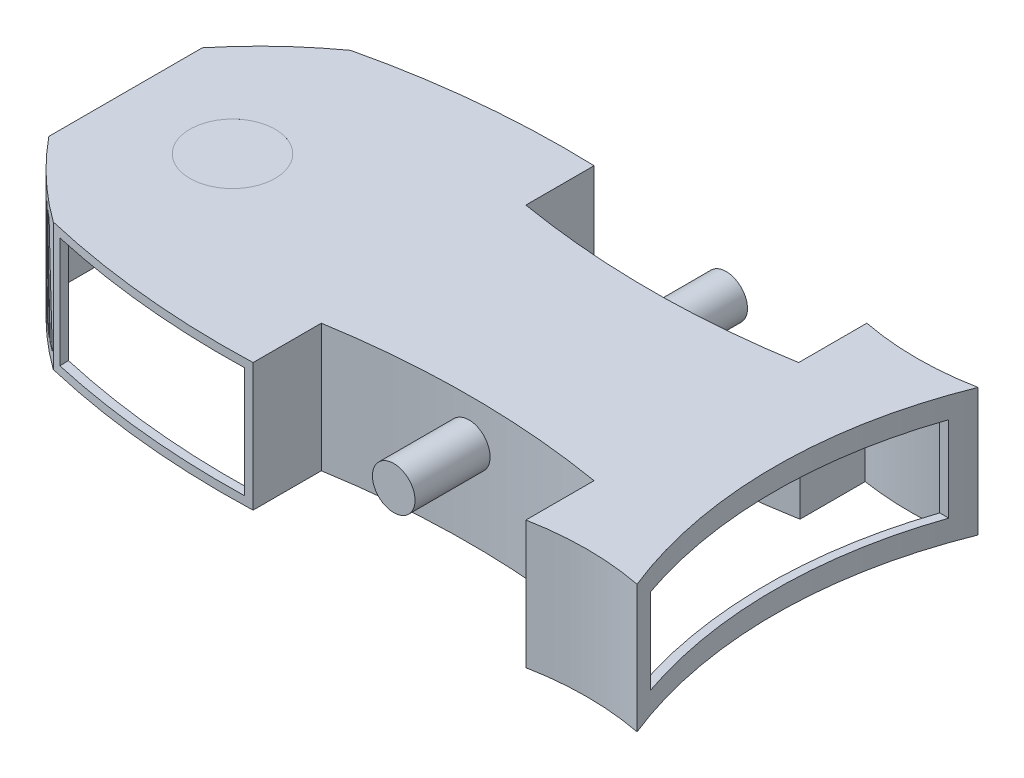
from build123d import *

# Parameters (mm, degrees)
BOSS_EXTRUDE2_DEPTH     = 38.1
F_3DSKETCH1_R           = 6.35
BOSS_EXTRUDE4_DEPTH     = 19.05
SHELL2_T                = -2.54
SKETCH6_R               = 12.7
CUT_EXTRUDE1_DEPTH      = 0.00254
CUT_EXTRUDE2_DEPTH      = 158.777237848
CUT_EXTRUDE2_DEPTH_BACK = 158.777237848
SKETCH7_W               = 60.703915542
SKETCH7_H               = 33.02
SKETCH8_W               = 88.9
SKETCH8_H               = 25.4
CUT_EXTRUDE4_DEPTH      = 16.51
CUT_EXTRUDE5_DEPTH      = 8.255
CUT_EXTRUDE6_DEPTH      = 8.255


with BuildPart() as part:
    # Sketch2 → Boss-Extrude2 (new body)
    with BuildSketch(Plane(origin=(0, 0, 0), x_dir=(1, 0, 0), z_dir=(0, 1, 0))):
        with BuildLine():
            Line((-110.287885986, 22.86), (-110.287885986, -22.86))
            ThreePointArc((-110.287885986, -22.86), (-99.613176325, -34.311972563), (-87.544453722, -44.284085511))
            ThreePointArc((-87.544453722, -44.284085511), (-54.73623967, -49.744240151), (-21.493532664, -50.8))
            Line((-21.493532664, -50.8), (-21.493532664, -30.48))
            ThreePointArc((-21.493532664, -30.48), (19.146467336, -27.087614792), (59.786467336, -30.48))
            Line((59.786467336, -30.48), (59.786467336, -50.8))
            ThreePointArc((59.786467336, -50.8), (76.349290675, -49.20544454), (92.912114014, -50.8))
            ThreePointArc((92.912114014, -50.8), (83.089159594, 0), (92.912114014, 50.8))
            ThreePointArc((92.912114014, 50.8), (76.349290675, 49.20544454), (59.786467336, 50.8))
            Line((59.786467336, 50.8), (59.786467336, 30.48))
            ThreePointArc((59.786467336, 30.48), (19.146467336, 27.087614792), (-21.493532664, 30.48))
            Line((-21.493532664, 30.48), (-21.493532664, 50.8))
            ThreePointArc((-21.493532664, 50.8), (-54.73623967, 49.744240151), (-87.544453722, 44.284085511))
            ThreePointArc((-87.544453722, 44.284085511), (-99.613176325, 34.311972563), (-110.287885986, 22.86))
        make_face()
    extrude(amount=BOSS_EXTRUDE2_DEPTH)

    # 3DSketch1 → Boss-Extrude4 (add, symmetric)
    with BuildSketch(Plane(origin=(19.146467336, 25.4, 30.48), x_dir=(-1, 0, 0), z_dir=(0, 0, -1))):
        Circle(F_3DSKETCH1_R)
    boss_extrude4 = extrude(amount=BOSS_EXTRUDE4_DEPTH, both=True)

    # Mirror2: Boss-Extrude4 across plane
    add(boss_extrude4.mirror(Plane(origin=(0, 0, 0), x_dir=(1, 0, 0), z_dir=(0, 0, -1))))

    # Shell2
    shell2_openings = [part.faces().sort_by_distance(p)[0] for p in [
        (-14.551940984, 0, 0),
    ]]
    offset(amount=SHELL2_T, openings=shell2_openings, kind=Kind.INTERSECTION)

    # Sketch6 → Cut-Extrude1 (cut)
    with BuildSketch(Plane(origin=(0, 38.1, 0), x_dir=(1, 0, 0), z_dir=(0, 1, 0))):
        with Locations((-78.424817078, 0)):
            Circle(SKETCH6_R)
    extrude(amount=-CUT_EXTRUDE1_DEPTH, mode=Mode.SUBTRACT)

    # Sketch7 → Cut-Extrude2 (cut, two sides: drawn at the far end of the back side and taken through both)
    with BuildSketch(Plane(origin=(-21.493532664, 0, 50.8), x_dir=(0.9993933308581496, 0, -0.034827722237509656), z_dir=(0.034827722237509656, 0, 0.9993933308581497)).offset(-CUT_EXTRUDE2_DEPTH_BACK)):
        with Locations((-32.891957771, 19.05)):
            Rectangle(SKETCH7_W, SKETCH7_H)
    extrude(amount=CUT_EXTRUDE2_DEPTH + CUT_EXTRUDE2_DEPTH_BACK, mode=Mode.SUBTRACT)

    # Sketch8 → Cut-Extrude4 (cut)
    with BuildSketch(Plane.ZY.offset(-92.912114014)):
        with Locations((0, 19.05)):
            Rectangle(SKETCH8_W, SKETCH8_H)
    extrude(amount=CUT_EXTRUDE4_DEPTH, mode=Mode.SUBTRACT)

    # Sketch9 → Cut-Extrude5 (cut, symmetric)
    with BuildSketch(Plane(origin=(-87.544453722, 0, 44.284085511), x_dir=(0.8106214663818172, 0, 0.5855705237125519), z_dir=(-0.5855705237125519, 0, 0.8106214663818172))):
        Polygon((-29.711627385, 34.29), (-26.301134111, 34.29), (-20.926687739, 3.81), (-24.337181013, 3.81), align=None)
        Polygon((-19.423009078, 3.81), (-24.79745545, 34.29), (-21.386962176, 34.29), (-16.012515804, 3.81), align=None)
        Polygon((-14.508837143, 3.81), (-19.883283515, 34.29), (-16.472790242, 34.29), (-11.09834387, 3.81), align=None)
        Polygon((-9.594665208, 3.81), (-14.96911158, 34.29), (-11.558618307, 34.29), (-6.184171935, 3.81), align=None)
        Polygon((-4.680493274, 3.81), (-10.054939646, 34.29), (-6.644446372, 34.29), (-1.27, 3.81), align=None)
    extrude(amount=CUT_EXTRUDE5_DEPTH, both=True, mode=Mode.SUBTRACT)

    # Sketch13 → Cut-Extrude6 (cut, symmetric)
    with BuildSketch(Plane(origin=(-87.544453722, 0, -44.284085511), x_dir=(0.8106214663818171, 0, -0.5855705237125521), z_dir=(0.5855705237125521, 0, 0.8106214663818171))):
        Polygon((-31.114524762, 33.640809935), (-27.704031489, 33.640809935), (-22.38171515, 3.456454047), (-25.792208424, 3.456454047), align=None)
        Polygon((-26.092601944, 33.843694963), (-20.718155572, 3.363694963), (-17.379639077, 3.363694963), (-22.754085449, 33.843694963), align=None)
        Polygon((-21.250406788, 33.843694963), (-15.875960416, 3.363694963), (-12.465467143, 3.363694963), (-17.839913515, 33.843694963), align=None)
        Polygon((-16.336234853, 33.843694963), (-10.961788481, 3.363694963), (-7.551295208, 3.363694963), (-12.92574158, 33.843694963), align=None)
        Polygon((-11.422062919, 33.843694963), (-6.047616547, 3.363694963), (-2.637123273, 3.363694963), (-8.011569645, 33.843694963), align=None)
    extrude(amount=CUT_EXTRUDE6_DEPTH, both=True, mode=Mode.SUBTRACT)


solid = part.part
